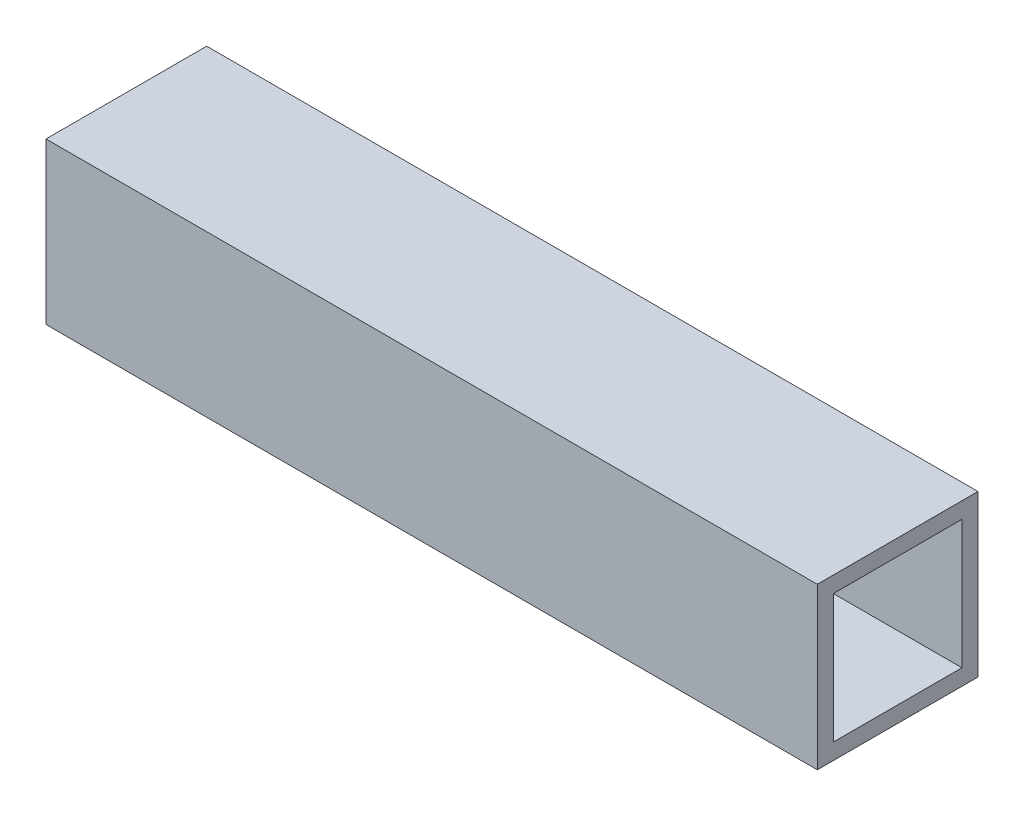
from build123d import *

# Parameters (mm, degrees)
SKETCH1_W           = 63.5
SKETCH1_H           = 63.5
SKETCH1_W_2         = 50.8
SKETCH1_H_2         = 50.8
BOSS_EXTRUDE1_DEPTH = 152.4


with BuildPart() as part:
    # Sketch1 → Boss-Extrude1 (new, symmetric)
    with BuildSketch(Plane(origin=(0, 0, 0), x_dir=(0, 0, -1), z_dir=(1, 0, 0))):
        Rectangle(SKETCH1_W, SKETCH1_H)
        Rectangle(SKETCH1_W_2, SKETCH1_H_2, mode=Mode.SUBTRACT)
    extrude(amount=BOSS_EXTRUDE1_DEPTH, both=True)


solid = part.part
